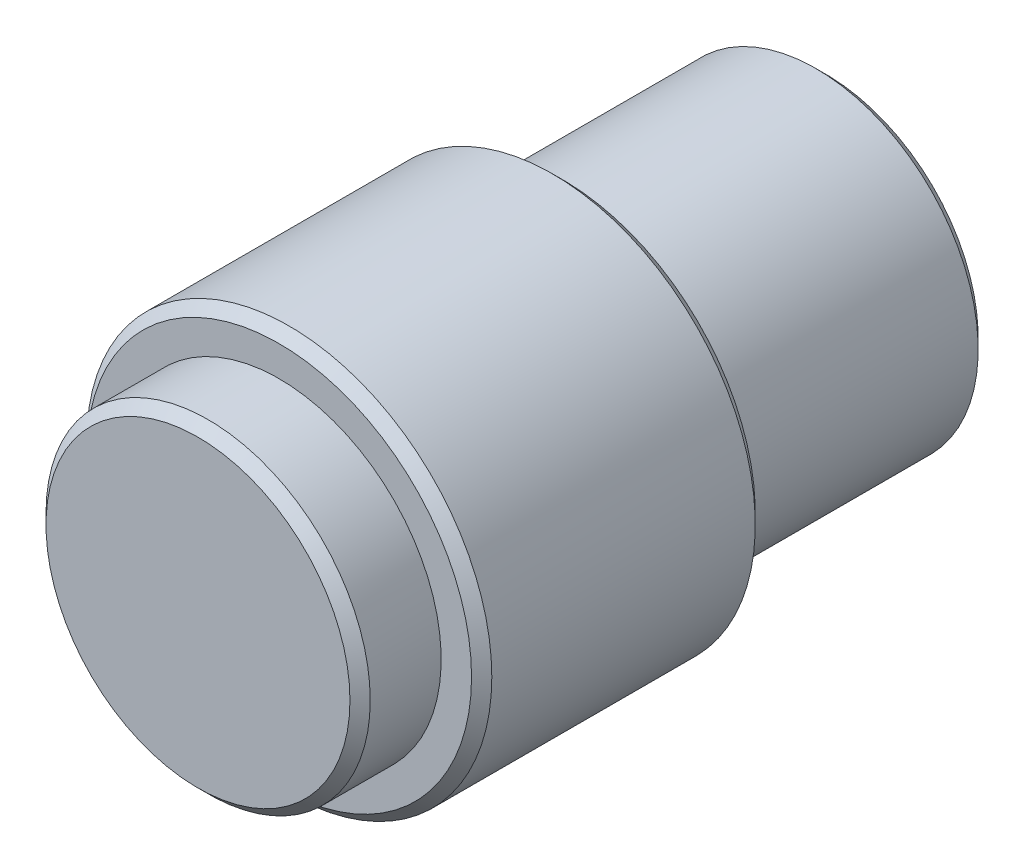
from build123d import *

# Parameters (mm, degrees)
CHAMFER_1_SIZE = 0.25


with BuildPart() as part:
    # ｽｹｯﾁ1 → 回転1 (revolve)
    with BuildSketch(Plane(origin=(0, 0, 0), x_dir=(0, 0, -1), z_dir=(1, 0, 0))):
        Polygon((0, 0), (0, 4), (2, 4), (2, 5), (9, 5), (9, 4), (15.5, 4), (15.5, 0), align=None)
    revolve(axis=Axis((0, 0, -15.5), (0, 0, 1)))

    # 面取り1
    chamfer_1_edges = [part.edges().sort_by_distance(p)[0] for p in [
        (0, -4, -15.5),
        (0, -4, 0),
        (0, -5, -9),
        (0, -5, -2),
    ]]
    chamfer(chamfer_1_edges, length=CHAMFER_1_SIZE)


solid = part.part
